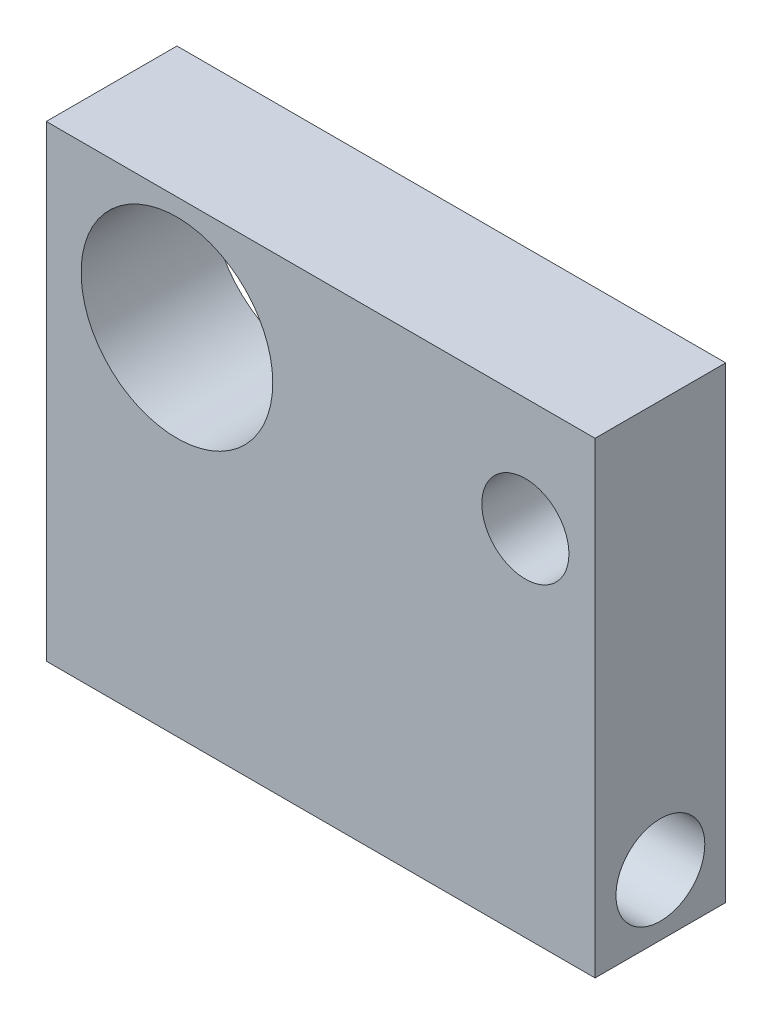
from build123d import *

# Parameters (mm, degrees)
SKETCH2_W           = 63
SKETCH2_H           = 53.66
SKETCH2_R           = 5
SKETCH2_R_2         = 11
BOSS_EXTRUDE1_DEPTH = 15
SKETCH3_R           = 5.1
CUT_EXTRUDE1_DEPTH  = 71.244392635


with BuildPart() as part:
    # Sketch2 → Boss-Extrude1 (new body)
    with BuildSketch(Plane.XY):
        with Locations((-0.443782019, -0.377989574)):
            Rectangle(SKETCH2_W, SKETCH2_H)
        with Locations((23.056217981, 13.452010426)):
            Circle(SKETCH2_R, mode=Mode.SUBTRACT)
        with Locations((-16.943782019, 13.452010426)):
            Circle(SKETCH2_R_2, mode=Mode.SUBTRACT)
    extrude(amount=BOSS_EXTRUDE1_DEPTH)

    # Sketch3 → Cut-Extrude1 (cut, through all)
    with BuildSketch(Plane(origin=(31.056217981, 0, 0), x_dir=(0, 0, -1), z_dir=(1, 0, 0))):
        with Locations((-7.5, -20.207989574)):
            Circle(SKETCH3_R)
    extrude(amount=-CUT_EXTRUDE1_DEPTH, mode=Mode.SUBTRACT)


solid = part.part
